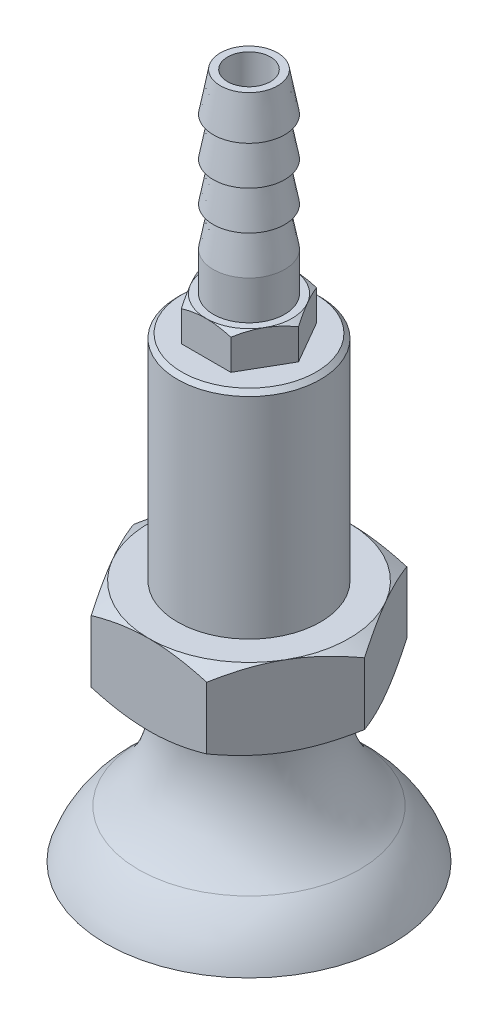
from build123d import *

# Parameters (mm, degrees)
EXTRUDE_START        = 10.4
EXTRUDE_1_DEPTH      = 2.4
CHAMFER_1_SIZE       = 0.3
EXTRUDE_START_2      = -7
EXTRUDE_3_DEPTH      = 5.6
CUT_EXTRUDE_START    = 10.4
SKETCH_6_OUTSIDE_W   = 41.456
SKETCH_6_OUTSIDE_H   = 41.456
SKETCH_6_OUTSIDE_R   = 3
CUT_EXTRUDE_1_DEPTH  = 2.4
CUT_EXTRUDE_1_DRAFT  = -60
CUT_EXTRUDE_START_2  = -7
SKETCH_7_5_OUTSIDE_W = 52.542
SKETCH_7_5_OUTSIDE_H = 52.542
SKETCH_7_5_OUTSIDE_R = 7
CUT_EXTRUDE_6_DEPTH  = 5.6
CUT_EXTRUDE_6_DRAFT  = -60
CUT_EXTRUDE_START_3  = -12.6
SKETCH_7_OUTSIDE_W   = 52.542
SKETCH_7_OUTSIDE_H   = 52.542
SKETCH_7_OUTSIDE_R   = 7
CUT_EXTRUDE_7_DEPTH  = 5.6
CUT_EXTRUDE_7_DRAFT  = 60
CUT_EXTRUDE_START_4  = 8
SKETCH_8_R           = 1.5
CUT_EXTRUDE_8_DEPTH  = 20.856776712
FILLET_1_R           = 8


with BuildPart() as part:
    # 草图2 → 旋转1 (revolve)
    with BuildSketch(Plane.XY):
        with BuildLine():
            Line((-3.35, -20.427420617), (-3.35, -21.7))
            ThreePointArc((-3.35, -21.7), (-6.77333928, -22.565671213), (-10, -24))
            ThreePointArc((-10, -24), (-8.448445591, -21.351381697), (-6, -19.5))
            ThreePointArc((-6, -19.5), (-5.145806832, -16.814398758), (-5, -14))
            Line((-5, -14), (-5, 8))
            Line((-5, 8), (-3, 8))
            Line((-3, 8), (-3, 10.4))
            Line((-3, 10.4), (-2.5, 10.4))
            Line((-2.5, 10.4), (-2.5, 13.12))
            Line((-2.5, 13.12), (-2, 15.84))
            Line((-2, 15.84), (-2.5, 15.84))
            Line((-2.5, 15.84), (-2, 18.56))
            Line((-2, 18.56), (-2.5, 18.56))
            Line((-2.5, 18.56), (-2, 21.28))
            Line((-2, 21.28), (-2.5, 21.28))
            Line((-2.5, 21.28), (-2, 24))
            Line((-2, 24), (0, 24))
            Line((0, 24), (0, -9.8))
            Line((0, -9.8), (-2.15, -9.8))
            Line((-2.15, -9.8), (-2.15, -20.427420617))
            Line((-2.15, -20.427420617), (-3.35, -20.427420617))
        make_face()
    revolve(axis=Axis((0, 24, 0), (0, -1, 0)))

    # 草图4 → 凸台-拉伸1 (add)
    with BuildSketch(Plane(origin=(0, 0, 0), x_dir=(1, 0, 0), z_dir=(0, 1, 0)).offset(EXTRUDE_START)):
        Polygon((3.464101615, 0), (1.732050808, 3), (-1.732050808, 3), (-3.464101615, 0), (-1.732050808, -3), (1.732050808, -3), align=None)
    extrude(amount=-EXTRUDE_1_DEPTH)

    # 倒角1
    chamfer_1_edges = [part.edges().sort_by_distance(p)[0] for p in [
        (5, 8, 0),
    ]]
    chamfer(chamfer_1_edges, length=CHAMFER_1_SIZE)

    # 草图5 → 凸台-拉伸3 (add)
    with BuildSketch(Plane(origin=(0, 0, 0), x_dir=(1, 0, 0), z_dir=(0, 1, 0)).offset(EXTRUDE_START_2)):
        Polygon((8.082903769, 0), (4.041451884, 7), (-4.041451884, 7), (-8.082903769, 0), (-4.041451884, -7), (4.041451884, -7), align=None)
    extrude(amount=-EXTRUDE_3_DEPTH)


with BuildPart() as cut_extrude_1_tool:
    # 草图6 outside → 切除-拉伸1 (with draft: the straight prism first)
    with BuildSketch(Plane(origin=(0, 0, 0), x_dir=(1, 0, 0), z_dir=(0, 1, 0)).offset(CUT_EXTRUDE_START)):
        Rectangle(SKETCH_6_OUTSIDE_W, SKETCH_6_OUTSIDE_H)
        Circle(SKETCH_6_OUTSIDE_R, mode=Mode.SUBTRACT)
    extrude(amount=-CUT_EXTRUDE_1_DEPTH)
    # 切除-拉伸1: the draft: its side faces are tilted about the plane it starts from
    cut_extrude_1_sides = [cut_extrude_1_tool.faces().sort_by_distance(p)[0] for p in [
        (0, 9.2, 20.728),
        (20.728, 9.2, 0),
        (0, 9.2, -20.728),
        (-20.728, 9.2, 0),
        (-3, 9.2, 0),
    ]]
    draft(cut_extrude_1_sides, Plane(origin=(0, 0, 0), x_dir=(1, 0, 0), z_dir=(0, 1, 0)).offset(CUT_EXTRUDE_START), CUT_EXTRUDE_1_DRAFT)


with BuildPart() as part_1:
    add(part.part)

    # 切除-拉伸1: cut by cut_extrude_1_tool
    add(cut_extrude_1_tool.part, mode=Mode.SUBTRACT)


with BuildPart() as cut_extrude_6_tool:
    # 草图7<5> outside → 切除-拉伸6 (with draft: the straight prism first)
    with BuildSketch(Plane(origin=(0, 0, 0), x_dir=(1, 0, 0), z_dir=(0, 1, 0)).offset(CUT_EXTRUDE_START_2)):
        Rectangle(SKETCH_7_5_OUTSIDE_W, SKETCH_7_5_OUTSIDE_H)
        Circle(SKETCH_7_5_OUTSIDE_R, mode=Mode.SUBTRACT)
    extrude(amount=-CUT_EXTRUDE_6_DEPTH)
    # 切除-拉伸6: the draft: its side faces are tilted about the plane it starts from
    cut_extrude_6_sides = [cut_extrude_6_tool.faces().sort_by_distance(p)[0] for p in [
        (0, -9.8, 26.271),
        (26.271, -9.8, 0),
        (0, -9.8, -26.271),
        (-26.271, -9.8, 0),
        (-7, -9.8, 0),
    ]]
    draft(cut_extrude_6_sides, Plane(origin=(0, 0, 0), x_dir=(1, 0, 0), z_dir=(0, 1, 0)).offset(CUT_EXTRUDE_START_2), CUT_EXTRUDE_6_DRAFT)


with BuildPart() as part_2:
    add(part_1.part)

    # 切除-拉伸6: cut by cut_extrude_6_tool
    add(cut_extrude_6_tool.part, mode=Mode.SUBTRACT)


with BuildPart() as cut_extrude_7_tool:
    # 草图7 outside → 切除-拉伸7 (with draft: the straight prism first)
    with BuildSketch(Plane(origin=(0, 0, 0), x_dir=(1, 0, 0), z_dir=(0, 1, 0)).offset(CUT_EXTRUDE_START_3)):
        Rectangle(SKETCH_7_OUTSIDE_W, SKETCH_7_OUTSIDE_H)
        Circle(SKETCH_7_OUTSIDE_R, mode=Mode.SUBTRACT)
    extrude(amount=CUT_EXTRUDE_7_DEPTH)
    # 切除-拉伸7: the draft: its side faces are tilted about the plane it starts from
    cut_extrude_7_sides = [cut_extrude_7_tool.faces().sort_by_distance(p)[0] for p in [
        (0, -9.8, 26.271),
        (26.271, -9.8, 0),
        (0, -9.8, -26.271),
        (-26.271, -9.8, 0),
        (-7, -9.8, 0),
    ]]
    draft(cut_extrude_7_sides, Plane(origin=(0, 0, 0), x_dir=(1, 0, 0), z_dir=(0, 1, 0)).offset(CUT_EXTRUDE_START_3), CUT_EXTRUDE_7_DRAFT)


with BuildPart() as part_3:
    add(part_2.part)

    # 切除-拉伸7: cut by cut_extrude_7_tool
    add(cut_extrude_7_tool.part, mode=Mode.SUBTRACT)

    # 草图8 → 切除-拉伸8 (cut, through all)
    with BuildSketch(Plane(origin=(0, 0, 0), x_dir=(1, 0, 0), z_dir=(0, 1, 0)).offset(CUT_EXTRUDE_START_4)):
        with Locations(Location((0, 0, 0), (0, 0, 270))):
            Circle(SKETCH_8_R)
    extrude(amount=CUT_EXTRUDE_8_DEPTH, mode=Mode.SUBTRACT)

    # 圆角1
    # the kernel refuses this fillet: 8 mm, written as the material it adds along each edge
    with BuildSketch(Plane(origin=(0, -19.5, 0), x_dir=(-1, 0, 0), z_dir=(0, 0, 1))) as fillet_1_piece_1:
        with BuildLine():
            CenterArc((12.977296699, -4.897723176), FILLET_1_R, 130.988837312, 53.328737775)
            Line((7.730000861, 1.140975888), (7.625054944, 1.261749869))
            ThreePointArc((7.625054944, 1.261749869), (6.814717072, 0.646729918), (5.930305892, 0.144023371))
            Line((5.930305892, 0.144023371), (5.854970869, 0.067576262))
            ThreePointArc((5.854970869, 0.067576262), (4.988387647, -2.656979572), (4.840454066, -5.512045536))
            Line((4.840454066, -5.512045536), (5, -5.5))
        make_face()
    revolve(axis=Axis((0, -19.5, 0), (0, -1, 0)))


solid = part_3.part
